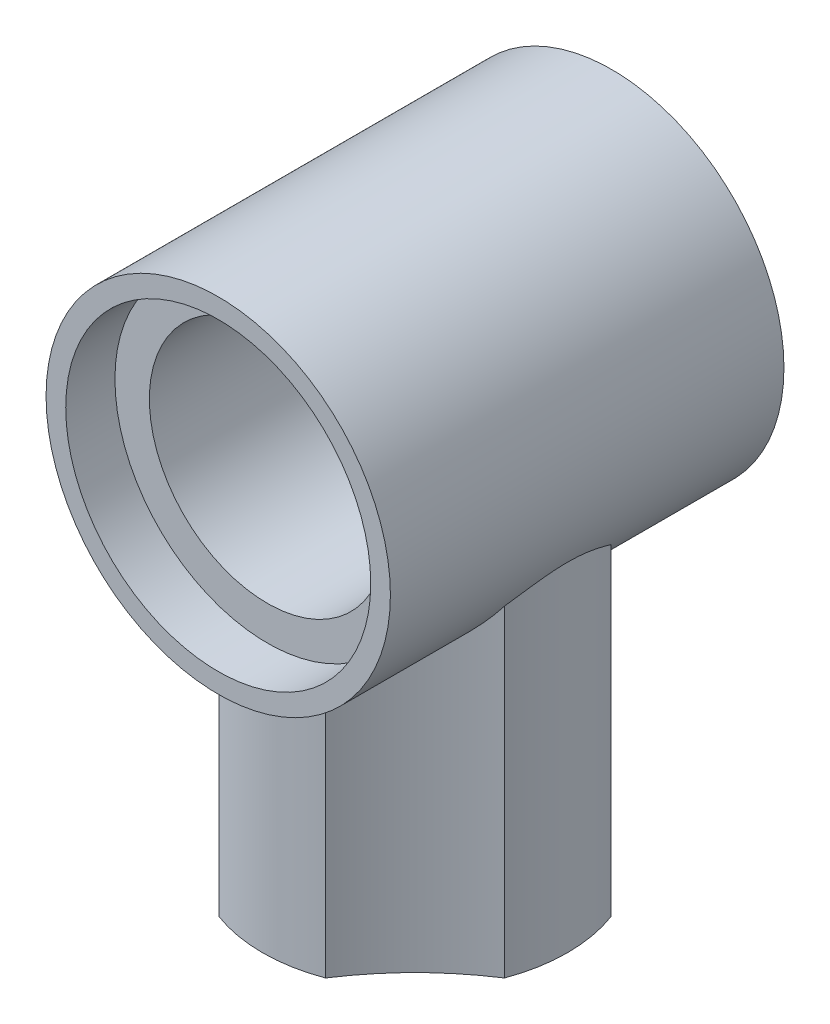
from build123d import *

# Parameters (mm, degrees)
BOSS_EXTRUDE1_DEPTH = 7
FILLET1_R           = 6.2
FILLET2_R           = 6.2
FILLET3_R           = 6.2
FILLET4_R           = 6.2
CUT_EXTRUDE1_DEPTH  = 5
SKETCH5_R           = 3.5
BOSS_EXTRUDE2_DEPTH = 4
SKETCH9_R           = 2.4
CUT_EXTRUDE2_DEPTH  = 15.840822238
SKETCH10_R          = 3.1
CUT_EXTRUDE3_DEPTH  = 1
FILLET5_R           = 0.4
FILLET6_R           = 0.4
FILLET7_R           = 0.4
FILLET8_R           = 0.4
FILLET9_R           = 0.1
FILLET10_R          = 0.1
FILLET11_R          = 0.1
FILLET12_R          = 0.1
FILLET13_R          = 0.1
FILLET14_R          = 0.1
FILLET15_R          = 0.1
FILLET16_R          = 0.1


with BuildPart() as part:
    # Sketch2 → Boss-Extrude1 (new body)
    with BuildSketch(Plane(origin=(0, 0, 0), x_dir=(1, 0, 0), z_dir=(0, 1, 0))):
        with BuildLine():
            Line((-1.085, -1.085), (-1.085, -2.903924069))
            ThreePointArc((-1.085, -2.903924069), (0, -3.1), (1.085, -2.903924069))
            Line((1.085, -2.903924069), (1.085, -1.085))
            Line((1.085, -1.085), (2.903924069, -1.085))
            ThreePointArc((2.903924069, -1.085), (3.1, 0), (2.903924069, 1.085))
            Line((2.903924069, 1.085), (1.085, 1.085))
            Line((1.085, 1.085), (1.085, 2.903924069))
            ThreePointArc((1.085, 2.903924069), (0, 3.1), (-1.085, 2.903924069))
            Line((-1.085, 2.903924069), (-1.085, 1.085))
            Line((-1.085, 1.085), (-2.903924069, 1.085))
            ThreePointArc((-2.903924069, 1.085), (-3.1, 0), (-2.903924069, -1.085))
            Line((-2.903924069, -1.085), (-1.085, -1.085))
        make_face()
    extrude(amount=BOSS_EXTRUDE1_DEPTH)

    # Fillet1
    # the kernel refuses this fillet: 6.2 mm, written as the material it adds along each edge
    with BuildSketch(Plane(origin=(-1.085, 0, -1.085), x_dir=(0, 0, -1), z_dir=(0, 1, 0))) as fillet1_piece_1:
        with BuildLine():
            CenterArc((5.198154004, 5.198154004), FILLET1_R, 213.027198012, 23.945603977)
            Line((0, 1.818924069), (0, 0))
            Line((0, 0), (1.818924069, 0))
        make_face()
    extrude(amount=7)

    # Fillet2
    # the kernel refuses this fillet: 6.2 mm, written as the material it adds along each edge
    with BuildSketch(Plane(origin=(1.085, 0, -1.085), x_dir=(0, 0, -1), z_dir=(0, 1, 0))) as fillet2_piece_1:
        with BuildLine():
            CenterArc((5.198154004, -5.198154004), FILLET2_R, 123.027198012, 23.945603977)
            Line((0, -1.818924069), (0, 0))
            Line((0, 0), (1.818924069, 0))
        make_face()
    extrude(amount=7)

    # Fillet3
    # the kernel refuses this fillet: 6.2 mm, written as the material it adds along each edge
    with BuildSketch(Plane(origin=(1.085, 0, 1.085), x_dir=(1, 0, 0), z_dir=(0, 1, 0))) as fillet3_piece_1:
        with BuildLine():
            CenterArc((5.198154004, -5.198154004), FILLET3_R, 123.027198012, 23.945603977)
            Line((0, -1.818924069), (0, 0))
            Line((0, 0), (1.818924069, 0))
        make_face()
    extrude(amount=7)

    # Fillet4
    # the kernel refuses this fillet: 6.2 mm, written as the material it adds along each edge
    with BuildSketch(Plane(origin=(-1.085, 0, 1.085), x_dir=(0, 0, 1), z_dir=(0, 1, 0))) as fillet4_piece_1:
        with BuildLine():
            CenterArc((5.198154004, -5.198154004), FILLET4_R, 123.027198012, 23.945603977)
            Line((0, -1.818924069), (0, 0))
            Line((0, 0), (1.818924069, 0))
        make_face()
    extrude(amount=7)

    # Sketch4 → Cut-Extrude1 (cut)
    with BuildSketch(Plane.XZ):
        with BuildLine():
            Line((0.84, 0.84), (0.84, 2.248199279))
            ThreePointArc((0.84, 2.248199279), (0, 2.4), (-0.84, 2.248199279))
            Line((-0.84, 2.248199279), (-0.84, 0.84))
            Line((-0.84, 0.84), (-2.248199279, 0.84))
            ThreePointArc((-2.248199279, 0.84), (-2.4, 0), (-2.248199279, -0.84))
            Line((-2.248199279, -0.84), (-0.84, -0.84))
            Line((-0.84, -0.84), (-0.84, -2.248199279))
            ThreePointArc((-0.84, -2.248199279), (0, -2.4), (0.84, -2.248199279))
            Line((0.84, -2.248199279), (0.84, -0.84))
            Line((0.84, -0.84), (2.248199279, -0.84))
            ThreePointArc((2.248199279, -0.84), (2.4, 0), (2.248199279, 0.84))
            Line((2.248199279, 0.84), (0.84, 0.84))
        make_face()
    extrude(amount=-CUT_EXTRUDE1_DEPTH, mode=Mode.SUBTRACT)

    # Sketch5 → Boss-Extrude2 (add, symmetric)
    with BuildSketch(Plane.XY):
        with Locations((0, 8.5)):
            Circle(SKETCH5_R)
    extrude(amount=BOSS_EXTRUDE2_DEPTH, both=True)

    # Sketch9 → Cut-Extrude2 (cut, through all)
    with BuildSketch(Plane.XY.offset(4)):
        with Locations((0, 8.5)):
            Circle(SKETCH9_R)
    extrude(amount=-CUT_EXTRUDE2_DEPTH, mode=Mode.SUBTRACT)

    # Sketch10 → Cut-Extrude3 (cut)
    with BuildSketch(Plane.XY.offset(4)):
        with Locations((0, 8.5)):
            Circle(SKETCH10_R)
    cut_extrude3 = extrude(amount=-CUT_EXTRUDE3_DEPTH, mode=Mode.SUBTRACT)

    # Mirror1: Cut-Extrude3 across plane
    add(cut_extrude3.mirror(Plane.XY), mode=Mode.SUBTRACT)

    # Fillet5
    fillet5_edges = [part.edges().sort_by_distance(p)[0] for p in [
        (0.84, 2.5, 0.84),
    ]]
    fillet(fillet5_edges, radius=FILLET5_R)

    # Fillet6
    fillet6_edges = [part.edges().sort_by_distance(p)[0] for p in [
        (-0.84, 2.5, 0.84),
    ]]
    fillet(fillet6_edges, radius=FILLET6_R)

    # Fillet7
    fillet7_edges = [part.edges().sort_by_distance(p)[0] for p in [
        (-0.84, 2.5, -0.84),
    ]]
    fillet(fillet7_edges, radius=FILLET7_R)

    # Fillet8
    fillet8_edges = [part.edges().sort_by_distance(p)[0] for p in [
        (0.84, 2.5, -0.84),
    ]]
    fillet(fillet8_edges, radius=FILLET8_R)

    # Fillet9
    fillet9_edges = [part.edges().sort_by_distance(p)[0] for p in [
        (-0.84, 2.5, 2.248199279),
    ]]
    fillet(fillet9_edges, radius=FILLET9_R)

    # Fillet10
    fillet10_edges = [part.edges().sort_by_distance(p)[0] for p in [
        (0.84, 2.5, 2.248199279),
    ]]
    fillet(fillet10_edges, radius=FILLET10_R)

    # Fillet11
    fillet11_edges = [part.edges().sort_by_distance(p)[0] for p in [
        (-2.248199279, 2.5, -0.84),
    ]]
    fillet(fillet11_edges, radius=FILLET11_R)

    # Fillet12
    fillet12_edges = [part.edges().sort_by_distance(p)[0] for p in [
        (-2.248199279, 2.5, 0.84),
    ]]
    fillet(fillet12_edges, radius=FILLET12_R)

    # Fillet13
    fillet13_edges = [part.edges().sort_by_distance(p)[0] for p in [
        (2.248199279, 2.5, 0.84),
    ]]
    fillet(fillet13_edges, radius=FILLET13_R)

    # Fillet14
    fillet14_edges = [part.edges().sort_by_distance(p)[0] for p in [
        (2.248199279, 2.5, -0.84),
    ]]
    fillet(fillet14_edges, radius=FILLET14_R)

    # Fillet15
    fillet15_edges = [part.edges().sort_by_distance(p)[0] for p in [
        (-0.84, 2.5, -2.248199279),
    ]]
    fillet(fillet15_edges, radius=FILLET15_R)

    # Fillet16
    fillet16_edges = [part.edges().sort_by_distance(p)[0] for p in [
        (0.84, 2.5, -2.248199279),
    ]]
    fillet(fillet16_edges, radius=FILLET16_R)


solid = part.part
